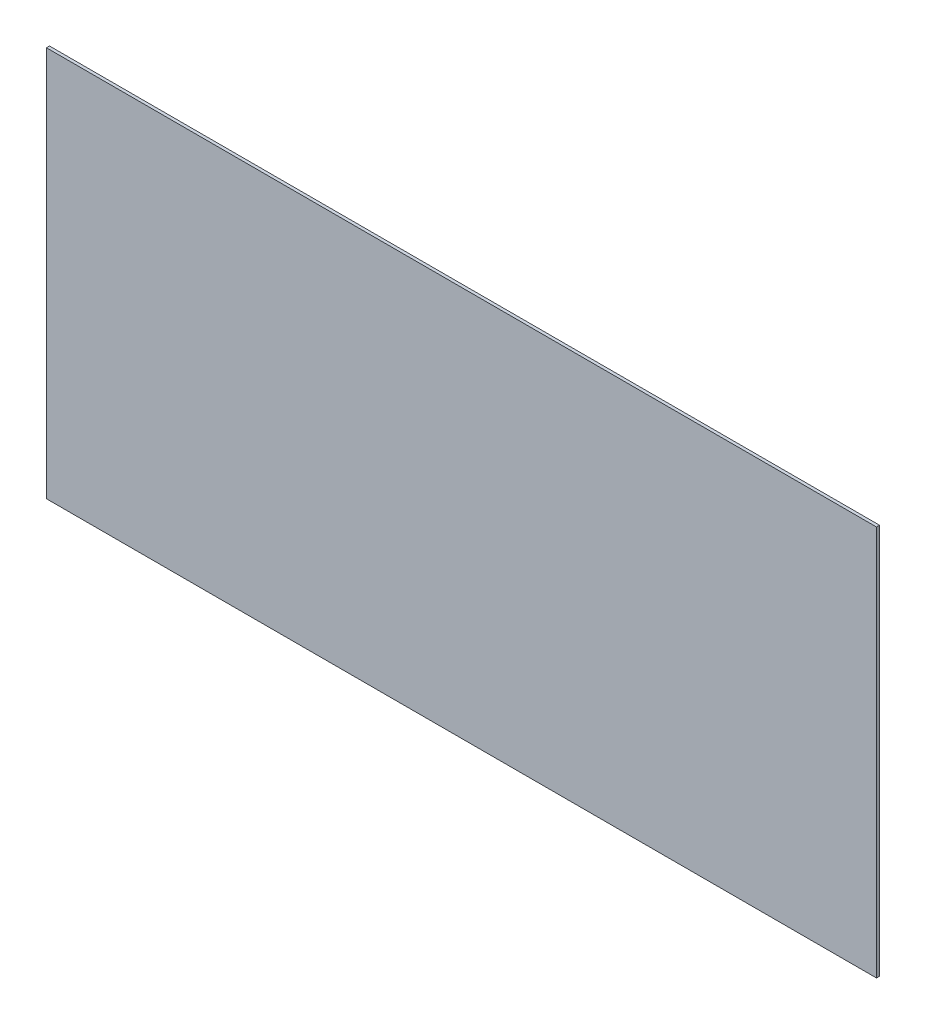
from build123d import *

# Parameters (mm, degrees)
SKETCH1_W           = 863.6
SKETCH1_H           = 406.4
BOSS_EXTRUDE1_DEPTH = 3.175


with BuildPart() as part:
    # Sketch1 → Boss-Extrude1 (new body)
    with BuildSketch(Plane.XY):
        Rectangle(SKETCH1_W, SKETCH1_H)
    extrude(amount=BOSS_EXTRUDE1_DEPTH)


solid = part.part
